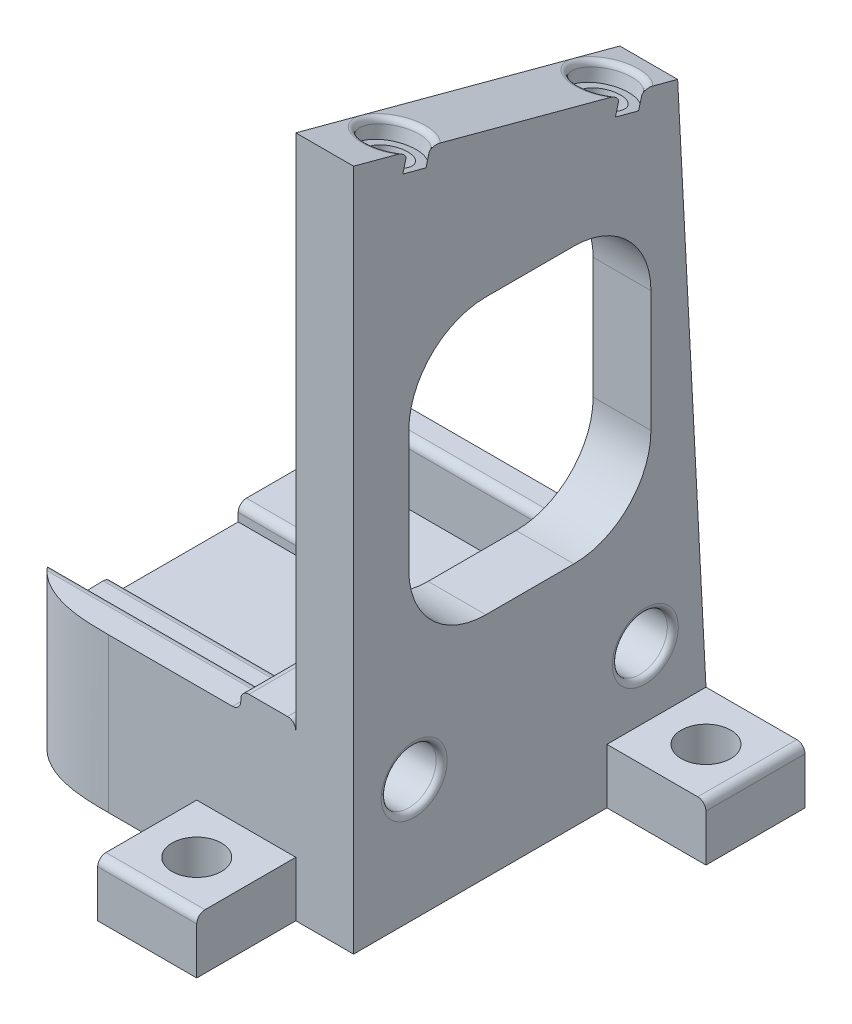
from build123d import *

# Parameters (mm, degrees)
BOSS_EXTRUDE1_DEPTH = 11
SKETCH3_W           = 22
SKETCH3_H           = 3
BOSS_EXTRUDE2_DEPTH = 14
BOSS_EXTRUDE3_DEPTH = 5
SKETCH5_R           = 1.75
CUT_EXTRUDE1_DEPTH  = 36.096650541
SKETCH6_W           = 9
SKETCH6_H           = 9
BOSS_EXTRUDE4_DEPTH = 5
SKETCH10_R          = 2.25
CUT_EXTRUDE2_DEPTH  = 34.584744739
FILLET1_R           = 0.75
FILLET2_SIZE        = 10
SKETCH12_W          = 9
SKETCH12_H          = 32.0178
BOSS_EXTRUDE5_DEPTH = 62
CUT_EXTRUDE4_DEPTH  = 9
SKETCH14_R          = 2.5
CUT_EXTRUDE5_DEPTH  = 9.75
SKETCH15_R          = 1.7
CUT_EXTRUDE6_DEPTH  = 5
SKETCH16_R          = 2.5
CUT_EXTRUDE7_DEPTH  = 1.6
FILLET3_R           = 0.5
FILLET4_R           = 0.5
SKETCH17_W          = 3.75
SKETCH17_H          = 32.0178
CUT_EXTRUDE9_DEPTH  = 72.375381621
SKETCH18_W          = 9
SKETCH18_H          = 9
BOSS_EXTRUDE6_DEPTH = 5
CUT_EXTRUDE10_REACH = 71.206
SKETCH19_R          = 2.25
FILLET6_START       = -17
FILLET6_DEPTH       = 11
CUT_EXTRUDE11_REACH = 74.1
SKETCH20_W          = 22
SKETCH20_H          = 25
CUT_EXTRUDE12_DEPTH = 75.22605744
FILLET7_START       = 16
FILLET7_DEPTH       = 5.25


with BuildPart() as part:
    # Sketch1 → Boss-Extrude1 (new, symmetric)
    with BuildSketch(Plane(origin=(0, 0, 0), x_dir=(0, 0, -1), z_dir=(1, 0, 0))):
        Polygon((-13.0089, 0), (13.0089, 0), (13.0089, 8.5), (5.7589, 8.5), (5.7589, 7), (-5.7589, 7), (-5.7589, 8.5), (-13.0089, 8.5), align=None)
    extrude(amount=BOSS_EXTRUDE1_DEPTH, both=True)

    # Sketch3 → Boss-Extrude2 (add)
    with BuildSketch(Plane.XZ):
        with Locations((0, -14.5089)):
            Rectangle(SKETCH3_W, SKETCH3_H)
        with Locations((0, 14.5089)):
            Rectangle(SKETCH3_W, SKETCH3_H)
    extrude(amount=-BOSS_EXTRUDE2_DEPTH)

    # Sketch4 → Boss-Extrude3 (add)
    with BuildSketch(Plane(origin=(11, 0, 0), x_dir=(0, 0, -1), z_dir=(1, 0, 0))):
        Polygon((-8.8, 15.7), (-16.0089, 15.7), (-16.0089, 0), (16.0089, 0), (16.0089, 15.7), align=None)
    extrude(amount=BOSS_EXTRUDE3_DEPTH)

    # Sketch5 → Cut-Extrude1 (cut, through all)
    with BuildSketch(Plane(origin=(16, 0, 0), x_dir=(0, 0, -1), z_dir=(1, 0, 0))):
        with Locations((-10.5, 11)):
            Circle(SKETCH5_R)
        with Locations((10.5, 11)):
            Circle(SKETCH5_R)
    extrude(amount=-CUT_EXTRUDE1_DEPTH, mode=Mode.SUBTRACT)

    # Sketch6 → Boss-Extrude4 (add)
    with BuildSketch(Plane.XZ):
        with Locations((11.5, 20.5089)):
            Rectangle(SKETCH6_W, SKETCH6_H)
    extrude(amount=-BOSS_EXTRUDE4_DEPTH)

    # Sketch10 → Cut-Extrude2 (cut, through all)
    with BuildSketch(Plane.XZ):
        with Locations(Location((11.5, 20.5089, 0), (0, 0, 270))):
            Circle(SKETCH10_R)
    extrude(amount=-CUT_EXTRUDE2_DEPTH, mode=Mode.SUBTRACT)

    # Fillet1
    fillet1_edges = [part.edges().sort_by_distance(p)[0] for p in [
        (0, 8.5, 5.7589),
        (0, 8.5, -5.7589),
        (0, 14, -13.0089),
        (11, 14, -14.5089),
        (11, 11.25, -13.0089),
        (11, 14, 14.5089),
        (11, 11.25, 13.0089),
        (0, 14, 13.0089),
        (11, 15.7, 0),
        (16, 15.7, 0),
        (11.5, 5, 25.0089),
    ]]
    fillet(fillet1_edges, radius=FILLET1_R)

    # Fillet2
    # a fillet whose section is not a circle: 10 mm, written as the material it takes off along each edge
    with BuildSketch(Plane(origin=(-11, -25, 16.0089), x_dir=(0, 0, -1), z_dir=(0, 1, 0))) as fillet2_piece_1:
        with BuildLine():
            add(Edge.make_bspline([(FILLET2_SIZE, 0), (FILLET2_SIZE * 0.831801948466, 0), (FILLET2_SIZE * 0.663603896932, 0), (FILLET2_SIZE * 0.292893218813, -FILLET2_SIZE * 0.0716919198361), (FILLET2_SIZE * 0.0716919198361, -FILLET2_SIZE * 0.292893218813), (0, -FILLET2_SIZE * 0.663603896932), (0, -FILLET2_SIZE * 0.831801948466), (0, -FILLET2_SIZE)], knots=[0, 0, 0, 0, 0, 0, 0.5, 0.5, 1, 1, 1, 1, 1, 1], degree=5))
            Line((0, -FILLET2_SIZE), (0, 0))
            Line((0, 0), (FILLET2_SIZE, 0))
        make_face()
    extrude(amount=64, mode=Mode.SUBTRACT)

    # Sketch12 → Boss-Extrude5 (add)
    with BuildSketch(Plane.XZ):
        with Locations((20.5, 0)):
            Rectangle(SKETCH12_W, SKETCH12_H)
    extrude(amount=-BOSS_EXTRUDE5_DEPTH)

    # Sketch13 → Cut-Extrude4 (cut)
    with BuildSketch(Plane(origin=(25, 0, 0), x_dir=(0, 0, -1), z_dir=(1, 0, 0))):
        Polygon((16.0089, 62), (-16.0089, 62), (16.0089, 53.420856347), align=None)
    extrude(amount=-CUT_EXTRUDE4_DEPTH, mode=Mode.SUBTRACT)

    # Sketch14 → Cut-Extrude5 (cut)
    with BuildSketch(Plane(origin=(25, 0, 0), x_dir=(0, 0, -1), z_dir=(1, 0, 0))):
        with Locations((-10.5, 11)):
            Circle(SKETCH14_R)
        with Locations((10.5, 11)):
            Circle(SKETCH14_R)
    extrude(amount=-CUT_EXTRUDE5_DEPTH, mode=Mode.SUBTRACT)

    # Sketch15 → Cut-Extrude6 (cut)
    with BuildSketch(Plane(origin=(0, 53.844562517, -14.427607043), x_dir=(1, 0, 0), z_dir=(0, 0.9659258262890701, -0.25881904510251424))):
        with Locations(Location((19, -5.362925068, 0), (0, 0, 270))):
            Circle(SKETCH15_R)
        with Locations(Location((19, -25.362925068, 0), (0, 0, 270))):
            Circle(SKETCH15_R)
    extrude(amount=-CUT_EXTRUDE6_DEPTH, mode=Mode.SUBTRACT)

    # Sketch16 → Cut-Extrude7 (cut)
    with BuildSketch(Plane(origin=(0, 53.844562517, -14.427607043), x_dir=(1, 0, 0), z_dir=(0, 0.9659258262890701, -0.25881904510251424))):
        with Locations(Location((19, -5.362925068, 0), (0, 0, 270))):
            Circle(SKETCH16_R)
        with Locations(Location((19, -25.362925068, 0), (0, 0, 270))):
            Circle(SKETCH16_R)
    extrude(amount=-CUT_EXTRUDE7_DEPTH, mode=Mode.SUBTRACT)

    # Fillet3
    fillet3_edges = [part.edges().sort_by_distance(p)[0] for p in [
        (19, 54.58554205, -11.662233782),
        (19, 59.761922952, 7.656282744),
    ]]
    fillet(fillet3_edges, radius=FILLET3_R)

    # Fillet4
    fillet4_edges = [part.edges().sort_by_distance(p)[0] for p in [
        (25, 11, 13),
        (25, 11, -8),
    ]]
    fillet(fillet4_edges, radius=FILLET4_R)

    # Sketch17 → Cut-Extrude9 (cut, through all)
    with BuildSketch(Plane(origin=(0, 62, 0), x_dir=(-1, 0, 0), z_dir=(0, -1, 0))):
        with Locations((-23.125, 0)):
            Rectangle(SKETCH17_W, SKETCH17_H)
    extrude(amount=CUT_EXTRUDE9_DEPTH, mode=Mode.SUBTRACT)

    # Fillet5: read off the stored shape, not the designer's step
    # Fillet5 outline → Fillet5 (revolve, cut)
    with BuildSketch(Plane(origin=(0, 11, -10.5), x_dir=(0, 1, 0), z_dir=(0, 0, -1))):
        with BuildLine():
            ThreePointArc((2.5, 20.75), (2.646446609, 21.103553391), (3, 21.25))
            Line((3, 21.25), (2.5, 21.25))
            Line((2.5, 21.25), (2.5, 20.75))
        make_face()
    revolve(axis=Axis((0, 11, -10.5), (1, 0, 0)), mode=Mode.SUBTRACT)

    # Fillet5 2 outline → Fillet5 2 (revolve, cut)
    with BuildSketch(Plane(origin=(0, 11, 10.5), x_dir=(0, 1, 0), z_dir=(0, 0, -1))):
        with BuildLine():
            ThreePointArc((2.5, 20.75), (2.646446609, 21.103553391), (3, 21.25))
            Line((3, 21.25), (2.5, 21.25))
            Line((2.5, 21.25), (2.5, 20.75))
        make_face()
    revolve(axis=Axis((0, 11, 10.5), (1, 0, 0)), mode=Mode.SUBTRACT)

    # Sketch18 → Boss-Extrude6 (add)
    with BuildSketch(Plane.XZ):
        with Locations((25.75, -11.5089)):
            Rectangle(SKETCH18_W, SKETCH18_H)
    extrude(amount=-BOSS_EXTRUDE6_DEPTH)

    # Sketch19 → Cut-Extrude10 (cut, up to next)
    with BuildSketch(Plane(origin=(0, 5, 0), x_dir=(1, 0, 0), z_dir=(0, 1, 0)), mode=Mode.PRIVATE) as cut_extrude10_sk1:
        with Locations(Location((25.75, 11.5089, 0), (0, 0, 270))):
            Circle(SKETCH19_R)
    cut_extrude10_tool1 = extrude(cut_extrude10_sk1.sketch, amount=-CUT_EXTRUDE10_REACH, mode=Mode.PRIVATE) & part.part
    add(cut_extrude10_tool1.solids().sort_by_distance((25.75, 5, -11.5089))[0], mode=Mode.SUBTRACT)

    # Fillet6: read off the stored shape, not the designer's step
    # Fillet6 outline → Fillet6 (cut)
    with BuildSketch(Plane.XY.offset(FILLET6_START)):
        with BuildLine():
            ThreePointArc((29.5, 5), (30.030330086, 4.780330086), (30.25, 4.25))
            Line((30.25, 4.25), (30.25, 5))
            Line((30.25, 5), (29.5, 5))
        make_face()
    extrude(amount=FILLET6_DEPTH, mode=Mode.SUBTRACT)

    # Sketch20 → Cut-Extrude11 (cut, up to next)
    with BuildSketch(Plane.ZY.offset(-16), mode=Mode.PRIVATE) as cut_extrude11_sk1:
        with Locations((-0.0089, 33.2)):
            Rectangle(SKETCH20_W, SKETCH20_H)
    cut_extrude11_tool1 = extrude(cut_extrude11_sk1.sketch, amount=-CUT_EXTRUDE11_REACH, mode=Mode.PRIVATE) & part.part
    add(cut_extrude11_tool1.solids().sort_by_distance((16, 33.2, -0.0089))[0], mode=Mode.SUBTRACT)

    # Sketch21 → Cut-Extrude12 (cut, through all)
    with BuildSketch(Plane(origin=(21.25, 0, 0), x_dir=(0, 0, -1), z_dir=(1, 0, 0))):
        Polygon((16.0089, 5), (16.0089, 53.420856347), (13.435127939, 54.110496492), align=None)
    extrude(amount=-CUT_EXTRUDE12_DEPTH, mode=Mode.SUBTRACT)

    # Fillet7: read off the stored shape, not the designer's step
    # Fillet7 outline → Fillet7 (add)
    with BuildSketch(Plane.YZ.offset(FILLET7_START)):
        with BuildLine():
            ThreePointArc((27.7, -11.0089), (22.750252532, -8.958647468), (20.7, -4.0089))
            Line((20.7, -4.0089), (20.7, -11.0089))
            Line((20.7, -11.0089), (27.7, -11.0089))
        make_face()
        with BuildLine():
            Line((20.7, 10.9911), (20.7, 3.9911))
            ThreePointArc((20.7, 3.9911), (22.750252532, 8.940847468), (27.7, 10.9911))
            Line((27.7, 10.9911), (20.7, 10.9911))
        make_face()
        with BuildLine():
            ThreePointArc((45.7, -4.0089), (43.649747468, -8.958647468), (38.7, -11.0089))
            Line((38.7, -11.0089), (45.7, -11.0089))
            Line((45.7, -11.0089), (45.7, -4.0089))
        make_face()
        with BuildLine():
            Line((45.7, 10.9911), (38.7, 10.9911))
            ThreePointArc((38.7, 10.9911), (43.649747468, 8.940847468), (45.7, 3.9911))
            Line((45.7, 3.9911), (45.7, 10.9911))
        make_face()
    extrude(amount=FILLET7_DEPTH)


solid = part.part
